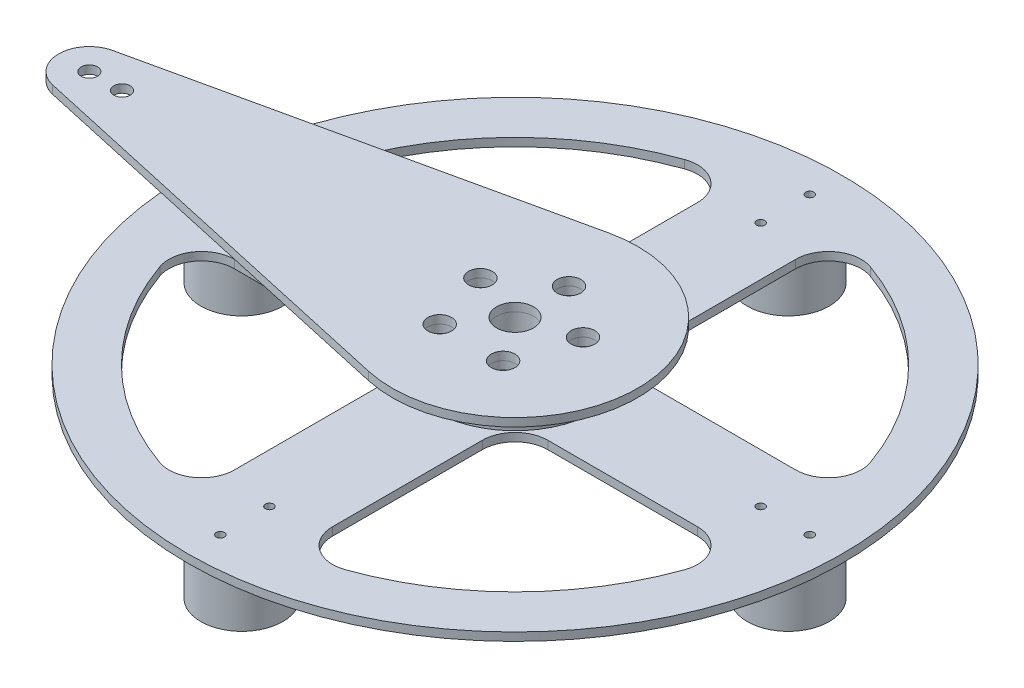
from build123d import *

# Parameters (mm, degrees)
SKETCH2_R           = 254
SKETCH2_R_2         = 14.2875
BOSS_EXTRUDE1_DEPTH = 6.35
SKETCH3_R           = 3.175
CUT_EXTRUDE1_DEPTH  = 360.266367059
SKETCH4_R           = 9.174592155
CUT_EXTRUDE2_DEPTH  = 360.266367059
BOSS_EXTRUDE2_START = 6.35
SKETCH5_R           = 62.886983285
SKETCH5_R_2         = 14.2875
SKETCH5_R_3         = 9.174592155
BOSS_EXTRUDE2_DEPTH = 6.35
SKETCH6_R           = 24.441804507
SKETCH6_R_2         = 14.2875
BOSS_EXTRUDE3_DEPTH = 12.7
BOSS_EXTRUDE4_START = 6.35
SKETCH7_R           = 9.174592155
SKETCH7_R_2         = 14.2875
SKETCH7_R_3         = 6.35
BOSS_EXTRUDE4_DEPTH = 6.35
SKETCH9_R           = 31.78887674
BOSS_EXTRUDE5_DEPTH = 44.45


# Read off the part's stored shape, not the designer's step: Split1
with BuildPart() as part:
    # Sketch2 → Boss-Extrude1 (new body)
    with BuildSketch(Plane(origin=(0, 0, 0), x_dir=(1, 0, 0), z_dir=(0, 1, 0))):
        with Locations(Location((0, 0, 0), (0, 0, 270))):
            Circle(SKETCH2_R)
        with Locations(Location((0, 0, 0), (0, 0, 270))):
            Circle(SKETCH2_R_2, mode=Mode.SUBTRACT)
    extrude(amount=BOSS_EXTRUDE1_DEPTH)

    # Sketch3 → Cut-Extrude1 (cut, through all)
    with BuildSketch(Plane(origin=(0, 6.35, 0), x_dir=(1, 0, 0), z_dir=(0, 1, 0))):
        with BuildLine():
            Line((-63.5, -38.1), (-179.605122421, -38.1))
            ThreePointArc((-179.605122421, -38.1), (-200.344135577, -48.835303163), (-203.552472078, -71.966666667))
            ThreePointArc((-203.552472078, -71.966666667), (-152.664354058, -152.664354058), (-71.966666667, -203.552472078))
            ThreePointArc((-71.966666667, -203.552472078), (-48.835303163, -200.344135577), (-38.1, -179.605122421))
            Line((-38.1, -179.605122421), (-38.1, -63.5))
            ThreePointArc((-38.1, -63.5), (-45.539487758, -45.539487758), (-63.5, -38.1))
        make_face()
        with BuildLine():
            ThreePointArc((-71.966666667, 203.552472078), (-152.664354058, 152.664354058), (-203.552472078, 71.966666667))
            ThreePointArc((-203.552472078, 71.966666667), (-200.344135577, 48.835303163), (-179.605122421, 38.1))
            Line((-179.605122421, 38.1), (-63.5, 38.1))
            ThreePointArc((-63.5, 38.1), (-45.539487758, 45.539487758), (-38.1, 63.5))
            Line((-38.1, 63.5), (-38.1, 179.605122421))
            ThreePointArc((-38.1, 179.605122421), (-48.835303163, 200.344135577), (-71.966666667, 203.552472078))
        make_face()
        with BuildLine():
            ThreePointArc((71.966666667, -203.552472078), (152.664354058, -152.664354058), (203.552472078, -71.966666667))
            ThreePointArc((203.552472078, -71.966666667), (200.344135577, -48.835303163), (179.605122421, -38.1))
            Line((179.605122421, -38.1), (63.5, -38.1))
            ThreePointArc((63.5, -38.1), (45.539487758, -45.539487758), (38.1, -63.5))
            Line((38.1, -63.5), (38.1, -179.605122421))
            ThreePointArc((38.1, -179.605122421), (48.835303163, -200.344135577), (71.966666667, -203.552472078))
        make_face()
        with BuildLine():
            ThreePointArc((203.552472078, 71.966666667), (152.664354058, 152.664354058), (71.966666667, 203.552472078))
            ThreePointArc((71.966666667, 203.552472078), (48.835303163, 200.344135577), (38.1, 179.605122421))
            Line((38.1, 179.605122421), (38.1, 63.5))
            ThreePointArc((38.1, 63.5), (45.539487758, 45.539487758), (63.5, 38.1))
            Line((63.5, 38.1), (179.605122421, 38.1))
            ThreePointArc((179.605122421, 38.1), (200.344135577, 48.835303163), (203.552472078, 71.966666667))
        make_face()
        with Locations(Location((-190.5, 0, 0), (0, 0, 270))):
            Circle(SKETCH3_R)
        with Locations(Location((-228.6, 0, 0), (0, 0, 270))):
            Circle(SKETCH3_R)
        with Locations(Location((0, -228.6, 0), (0, 0, 270))):
            Circle(SKETCH3_R)
        with Locations(Location((0, -190.5, 0), (0, 0, 270))):
            Circle(SKETCH3_R)
        with Locations(Location((190.5, 0, 0), (0, 0, 270))):
            Circle(SKETCH3_R)
        with Locations(Location((228.6, 0, 0), (0, 0, 270))):
            Circle(SKETCH3_R)
        with Locations(Location((0, 228.6, 0), (0, 0, 270))):
            Circle(SKETCH3_R)
        with Locations(Location((0, 190.5, 0), (0, 0, 270))):
            Circle(SKETCH3_R)
    extrude(amount=-CUT_EXTRUDE1_DEPTH, mode=Mode.SUBTRACT)

    # Sketch4 → Cut-Extrude2 (cut, through all)
    with BuildSketch(Plane(origin=(0, 6.35, 0), x_dir=(1, 0, 0), z_dir=(0, 1, 0))):
        with Locations(Location((0, 41.820824684, 0), (0, 0, 270))):
            Circle(SKETCH4_R)
        with Locations(Location((39.773967832, 12.923345546, 0), (0, 0, 270))):
            Circle(SKETCH4_R)
        with Locations(Location((24.581663988, -33.833757888, 0), (0, 0, 270))):
            Circle(SKETCH4_R)
        with Locations(Location((-24.581663988, -33.833757888, 0), (0, 0, 270))):
            Circle(SKETCH4_R)
        with Locations(Location((-39.773967832, 12.923345546, 0), (0, 0, 270))):
            Circle(SKETCH4_R)
    extrude(amount=-CUT_EXTRUDE2_DEPTH, mode=Mode.SUBTRACT)

    # Sketch5 → Boss-Extrude2 (add)
    with BuildSketch(Plane(origin=(0, 6.35, 0), x_dir=(1, 0, 0), z_dir=(0, 1, 0)).offset(BOSS_EXTRUDE2_START)):
        with Locations(Location((0, 0, 0), (0, 0, 270))):
            Circle(SKETCH5_R)
        with Locations(Location((0, 0, 0), (0, 0, 270))):
            Circle(SKETCH5_R_2, mode=Mode.SUBTRACT)
        with Locations(Location((24.581663988, -33.833757888, 0), (0, 0, 270))):
            Circle(SKETCH5_R_3, mode=Mode.SUBTRACT)
        with Locations(Location((39.773967832, 12.923345546, 0), (0, 0, 270))):
            Circle(SKETCH5_R_3, mode=Mode.SUBTRACT)
        with Locations(Location((0, 41.820824684, 0), (0, 0, 270))):
            Circle(SKETCH5_R_3, mode=Mode.SUBTRACT)
        with Locations(Location((-39.773967832, 12.923345546, 0), (0, 0, 270))):
            Circle(SKETCH5_R_3, mode=Mode.SUBTRACT)
        with Locations(Location((-24.581663988, -33.833757888, 0), (0, 0, 270))):
            Circle(SKETCH5_R_3, mode=Mode.SUBTRACT)
    boss_extrude2 = extrude(amount=-BOSS_EXTRUDE2_DEPTH)

    # Sketch6 → Boss-Extrude3 (add)
    with BuildSketch(Plane(origin=(0, 12.7, 0), x_dir=(1, 0, 0), z_dir=(0, 1, 0))):
        with Locations(Location((0, 0, 0), (0, 0, 270))):
            Circle(SKETCH6_R)
        with Locations(Location((0, 0, 0), (0, 0, 270))):
            Circle(SKETCH6_R_2, mode=Mode.SUBTRACT)
    extrude(amount=BOSS_EXTRUDE3_DEPTH)

    # Mirror1: Boss-Extrude2 across plane
    add(boss_extrude2.mirror(Plane.ZX.offset(19.05)))

    # Sketch7 → Boss-Extrude4 (add)
    with BuildSketch(Plane(origin=(0, 31.75, 0), x_dir=(1, 0, 0), z_dir=(0, 1, 0)).offset(BOSS_EXTRUDE4_START)):
        with BuildLine():
            Line((-335.347288867, 23.217919665), (-20.615873228, 92.992194678))
            ThreePointArc((-20.615873228, 92.992194678), (95.25, 0), (-20.615873228, -92.992194678))
            Line((-20.615873228, -92.992194678), (-335.347288867, -23.217919665))
            ThreePointArc((-335.347288867, -23.217919665), (-353.981639478, 0), (-335.347288867, 23.217919665))
        make_face()
        with Locations(Location((24.581663988, -33.833757888, 0), (0, 0, 270))):
            Circle(SKETCH7_R, mode=Mode.SUBTRACT)
        with Locations(Location((0, 0, 0), (0, 0, 270))):
            Circle(SKETCH7_R_2, mode=Mode.SUBTRACT)
        with Locations(Location((39.773967832, 12.923345546, 0), (0, 0, 270))):
            Circle(SKETCH7_R, mode=Mode.SUBTRACT)
        with Locations(Location((0, 41.820824684, 0), (0, 0, 270))):
            Circle(SKETCH7_R, mode=Mode.SUBTRACT)
        with Locations(Location((-39.773967832, 12.923345546, 0), (0, 0, 270))):
            Circle(SKETCH7_R, mode=Mode.SUBTRACT)
        with Locations(Location((-24.581663988, -33.833757888, 0), (0, 0, 270))):
            Circle(SKETCH7_R, mode=Mode.SUBTRACT)
        with Locations(Location((-330.2, 0, 0), (0, 0, 270))):
            Circle(SKETCH7_R_3, mode=Mode.SUBTRACT)
        with Locations(Location((-304.8, 0, 0), (0, 0, 270))):
            Circle(SKETCH7_R_3, mode=Mode.SUBTRACT)
    extrude(amount=-BOSS_EXTRUDE4_DEPTH)

    # Sketch9 → Boss-Extrude5 (add)
    with BuildSketch(Plane.XZ):
        with Locations(Location((-211.87788303, 0, 0), (0, 0, 90))):
            Circle(SKETCH9_R)
        with Locations(Location((0, 211.87788303, 0), (0, 0, 90))):
            Circle(SKETCH9_R)
        with Locations(Location((211.87788303, 0, 0), (0, 0, 90))):
            Circle(SKETCH9_R)
        with Locations(Location((0, -211.87788303, 0), (0, 0, 90))):
            Circle(SKETCH9_R)
    extrude(amount=BOSS_EXTRUDE5_DEPTH)


with BuildPart() as body_2:
    # Split1: the piece on the far side of the plane
    add(part.part)
    split(bisect_by=Plane(origin=(0, 31.75, 0), x_dir=(1, 0, 0), z_dir=(0, 1, 0)), keep=Keep.BOTTOM)


with BuildPart() as part_1:
    add(part.part)

    # Split1
    split(bisect_by=Plane(origin=(0, 31.75, 0), x_dir=(1, 0, 0), z_dir=(0, 1, 0)), keep=Keep.TOP)


solid = Compound([body_2.part, part_1.part])
